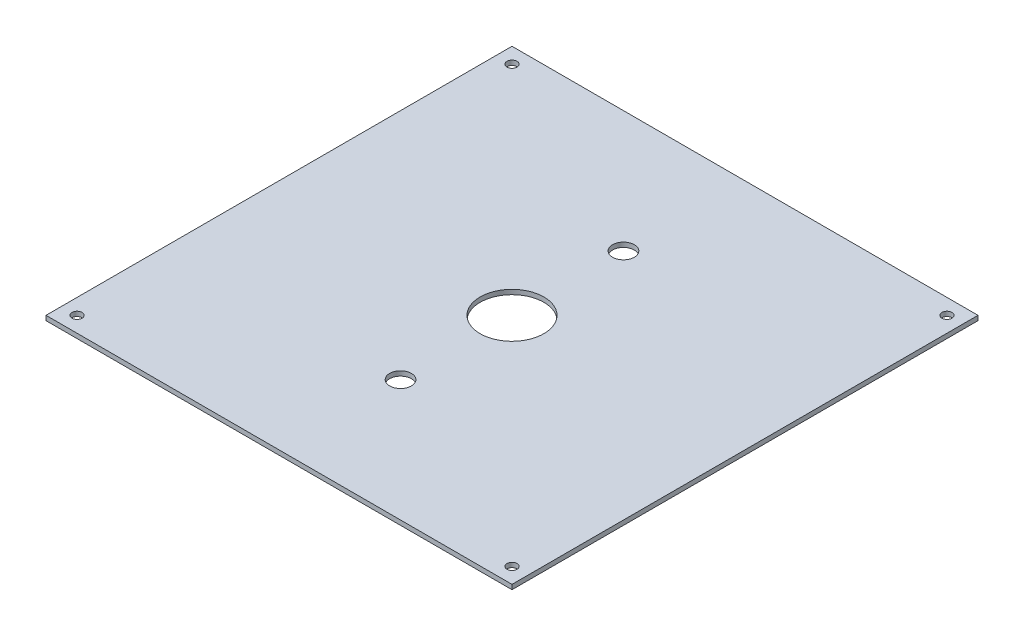
from build123d import *

# Parameters (mm, degrees)
SKETCH1_W           = 300
SKETCH1_H           = 300
BOSS_EXTRUDE1_DEPTH = 3
CUT_EXTRUDE1_REACH  = 214.153
SKETCH2_R           = 3.25
CUT_EXTRUDE2_REACH  = 214.153
SKETCH3_R           = 20.5
CUT_EXTRUDE3_REACH  = 214.153
SKETCH4_R           = 7


with BuildPart() as part:
    # Sketch1 → Boss-Extrude1 (new body)
    with BuildSketch(Plane(origin=(0, 0, 0), x_dir=(1, 0, 0), z_dir=(0, 1, 0))):
        Rectangle(SKETCH1_W, SKETCH1_H)
    extrude(amount=BOSS_EXTRUDE1_DEPTH)

    # Sketch2 → Cut-Extrude1 (cut, up to next)
    with BuildSketch(Plane(origin=(0, 3, 0), x_dir=(1, 0, 0), z_dir=(0, 1, 0)), mode=Mode.PRIVATE) as cut_extrude1_sk1:
        with Locations((-140, 140)):
            Circle(SKETCH2_R)
    cut_extrude1_tool1 = extrude(cut_extrude1_sk1.sketch, amount=-CUT_EXTRUDE1_REACH, mode=Mode.PRIVATE) & part.part
    # Sketch2 → Cut-Extrude1 (cut, up to next)
    with BuildSketch(Plane(origin=(0, 3, 0), x_dir=(1, 0, 0), z_dir=(0, 1, 0)), mode=Mode.PRIVATE) as cut_extrude1_sk2:
        with Locations((140, 140)):
            Circle(SKETCH2_R)
    cut_extrude1_tool2 = extrude(cut_extrude1_sk2.sketch, amount=-CUT_EXTRUDE1_REACH, mode=Mode.PRIVATE) & part.part
    # Sketch2 → Cut-Extrude1 (cut, up to next)
    with BuildSketch(Plane(origin=(0, 3, 0), x_dir=(1, 0, 0), z_dir=(0, 1, 0)), mode=Mode.PRIVATE) as cut_extrude1_sk3:
        with Locations((140, -140)):
            Circle(SKETCH2_R)
    cut_extrude1_tool3 = extrude(cut_extrude1_sk3.sketch, amount=-CUT_EXTRUDE1_REACH, mode=Mode.PRIVATE) & part.part
    # Sketch2 → Cut-Extrude1 (cut, up to next)
    with BuildSketch(Plane(origin=(0, 3, 0), x_dir=(1, 0, 0), z_dir=(0, 1, 0)), mode=Mode.PRIVATE) as cut_extrude1_sk4:
        with Locations((-140, -140)):
            Circle(SKETCH2_R)
    cut_extrude1_tool4 = extrude(cut_extrude1_sk4.sketch, amount=-CUT_EXTRUDE1_REACH, mode=Mode.PRIVATE) & part.part
    add(cut_extrude1_tool1.solids().sort_by_distance((-140, 3, -140))[0], mode=Mode.SUBTRACT)
    add(cut_extrude1_tool2.solids().sort_by_distance((140, 3, -140))[0], mode=Mode.SUBTRACT)
    add(cut_extrude1_tool3.solids().sort_by_distance((140, 3, 140))[0], mode=Mode.SUBTRACT)
    add(cut_extrude1_tool4.solids().sort_by_distance((-140, 3, 140))[0], mode=Mode.SUBTRACT)

    # Sketch3 → Cut-Extrude2 (cut, up to next)
    with BuildSketch(Plane(origin=(0, 3, 0), x_dir=(1, 0, 0), z_dir=(0, 1, 0)), mode=Mode.PRIVATE) as cut_extrude2_sk1:
        Circle(SKETCH3_R)
    cut_extrude2_tool1 = extrude(cut_extrude2_sk1.sketch, amount=-CUT_EXTRUDE2_REACH, mode=Mode.PRIVATE) & part.part
    add(cut_extrude2_tool1.solids().sort_by_distance((0, 3, 0))[0], mode=Mode.SUBTRACT)

    # Sketch4 → Cut-Extrude3 (cut, up to next)
    with BuildSketch(Plane(origin=(0, 3, 0), x_dir=(1, 0, 0), z_dir=(0, 1, 0)), mode=Mode.PRIVATE) as cut_extrude3_sk1:
        with Locations((0, 71.75)):
            Circle(SKETCH4_R)
    cut_extrude3_tool1 = extrude(cut_extrude3_sk1.sketch, amount=-CUT_EXTRUDE3_REACH, mode=Mode.PRIVATE) & part.part
    # Sketch4 → Cut-Extrude3 (cut, up to next)
    with BuildSketch(Plane(origin=(0, 3, 0), x_dir=(1, 0, 0), z_dir=(0, 1, 0)), mode=Mode.PRIVATE) as cut_extrude3_sk2:
        with Locations((0, -71.75)):
            Circle(SKETCH4_R)
    cut_extrude3_tool2 = extrude(cut_extrude3_sk2.sketch, amount=-CUT_EXTRUDE3_REACH, mode=Mode.PRIVATE) & part.part
    add(cut_extrude3_tool1.solids().sort_by_distance((0, 3, -71.75))[0], mode=Mode.SUBTRACT)
    add(cut_extrude3_tool2.solids().sort_by_distance((0, 3, 71.75))[0], mode=Mode.SUBTRACT)


solid = part.part
